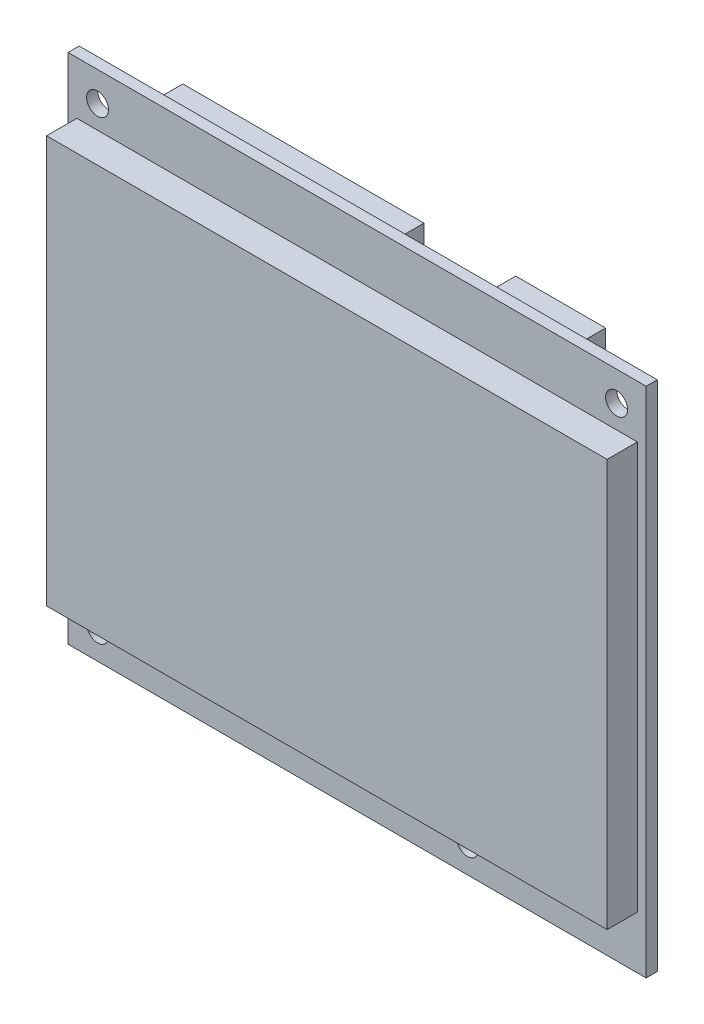
from build123d import *

# Parameters (mm, degrees)
SKETCH1_W           = 81.6864
SKETCH1_H           = 72.4154
BOSS_EXTRUDE1_DEPTH = 1.5748
SKETCH2_W           = 79.2
SKETCH2_H           = 57.54
BOSS_EXTRUDE2_DEPTH = 4.27
SKETCH4_R           = 1.55
CUT_EXTRUDE1_DEPTH  = 58.007790104
SKETCH3_W           = 12.7
SKETCH3_H           = 5.08
SKETCH3_W_2         = 34.071115987
BOSS_EXTRUDE3_DEPTH = 5.08
SKETCH5_W           = 11.143297124
SKETCH5_H           = 14.820585176
SKETCH5_W_2         = 5.702652661
SKETCH5_H_2         = 0.935331402
BOSS_EXTRUDE4_DEPTH = 1


with BuildPart() as part:
    # Sketch1 → Boss-Extrude1 (new body)
    with BuildSketch(Plane(origin=(0, 0, 0), x_dir=(-1, 0, 0), z_dir=(0, 0, -1))):
        with Locations((2.8, 0)):
            Rectangle(SKETCH1_W, SKETCH1_H)
    extrude(amount=BOSS_EXTRUDE1_DEPTH)

    # Sketch2 → Boss-Extrude2 (add)
    with BuildSketch(Plane(origin=(0, 0, 0), x_dir=(-1, 0, 0), z_dir=(0, 0, -1))):
        with Locations((2.8, 0)):
            Rectangle(SKETCH2_W, SKETCH2_H)
    extrude(amount=-BOSS_EXTRUDE2_DEPTH)

    # Sketch4 → Cut-Extrude1 (cut, through all)
    with BuildSketch(Plane(origin=(0, 0, -1.5748), x_dir=(-1, 0, 0), z_dir=(0, 0, -1))):
        with Locations((39.4682, 32.0327)):
            Circle(SKETCH4_R)
        with Locations((39.4682, -32.4077)):
            Circle(SKETCH4_R)
        with Locations((-12.7918, -32.4077)):
            Circle(SKETCH4_R)
        with Locations((-33.8682, 32.0327)):
            Circle(SKETCH4_R)
    extrude(amount=-CUT_EXTRUDE1_DEPTH, mode=Mode.SUBTRACT)

    # Sketch3 → Boss-Extrude3 (add)
    with BuildSketch(Plane.XY.offset(-1.5748)):
        with Locations((19.31004682, 31.274104804)):
            Rectangle(SKETCH3_W, SKETCH3_H)
        with Locations((-17.035557993, 31.274104804)):
            Rectangle(SKETCH3_W_2, SKETCH3_H)
        with Locations((-17.035557993, -31.699250815)):
            Rectangle(SKETCH3_W_2, SKETCH3_H)
    extrude(amount=-BOSS_EXTRUDE3_DEPTH)

    # Sketch5 → Boss-Extrude4 (add)
    with BuildSketch(Plane(origin=(0, 0, -1.5748), x_dir=(-1, 0, 0), z_dir=(0, 0, -1))):
        Polygon((19.476551601, 13.535617464), (30.731281697, 2.280887368), (19.476551601, -8.973842728), (8.221821505, 2.280887368), align=None)
        with Locations((-21.419348846, -17.387032057)):
            Rectangle(SKETCH5_W, SKETCH5_H)
        with Locations((-34.20974354, -34.592993391)):
            Rectangle(SKETCH5_W_2, SKETCH5_H_2)
    extrude(amount=BOSS_EXTRUDE4_DEPTH)


solid = part.part
